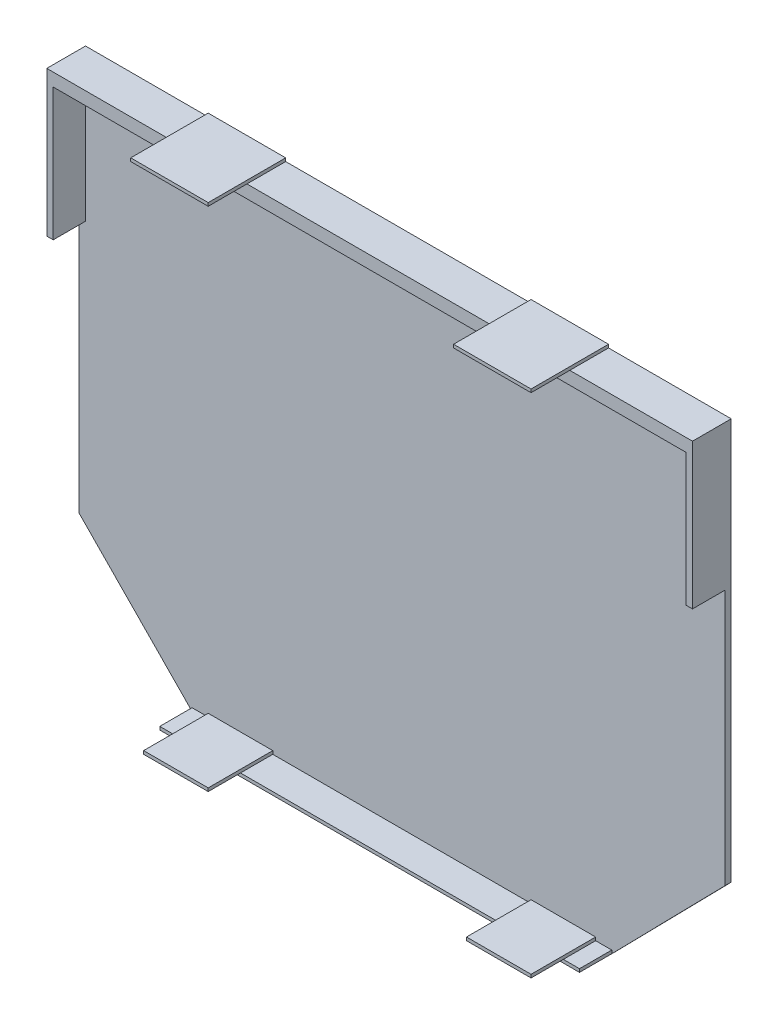
from build123d import *

# Parameters (mm, degrees)
STOCK_PART1_1_START       = -61
STOCK_PART1_1_DEPTH       = 2
STOCK_PART1_1_START_2     = -59
STOCK_PART1_1_2_OUTLINE_W = 130
STOCK_PART1_1_2_OUTLINE_H = 1
STOCK_PART1_1_2_DEPTH     = 10
SKETCH1_W                 = 24
SKETCH1_H                 = 24
BOSS_EXTRUDE1_DEPTH       = 1
SKETCH2_W                 = 20
SKETCH2_H                 = 20
BOSS_EXTRUDE2_DEPTH       = 1


# Read off the part's stored shape, not the designer's step: Stock-Part1-1
with BuildPart() as part:
    # Stock-Part1-1 outline → Stock-Part1-1 (new body)
    with BuildSketch(Plane.XY.offset(STOCK_PART1_1_START)):
        Polygon((0, 35.707142143), (35, 0), (165, 0), (200, 35.707142143), (200, 160), (0, 160), align=None)
    extrude(amount=STOCK_PART1_1_DEPTH)

    # Stock-Part1-1 2 outline → Stock-Part1-1 2 (add)
    with BuildSketch(Plane.XY.offset(STOCK_PART1_1_START_2)):
        with Locations((100, 0.5)):
            Rectangle(STOCK_PART1_1_2_OUTLINE_W, STOCK_PART1_1_2_OUTLINE_H)
        Polygon((198, 115), (200, 115), (200, 160), (0, 160), (0, 115), (2, 115), (2, 156), (198, 156), align=None)
    extrude(amount=STOCK_PART1_1_2_DEPTH)

    # Sketch1 → Boss-Extrude1 (add)
    with BuildSketch(Plane(origin=(0, 160, 0), x_dir=(1, 0, 0), z_dir=(0, 1, 0))):
        with Locations((150, 49)):
            Rectangle(SKETCH1_W, SKETCH1_H)
        with Locations((50, 49)):
            Rectangle(SKETCH1_W, SKETCH1_H)
    extrude(amount=BOSS_EXTRUDE1_DEPTH)

    # Sketch2 → Boss-Extrude2 (add)
    with BuildSketch(Plane(origin=(0, 1, 0), x_dir=(1, 0, 0), z_dir=(0, 1, 0))):
        with Locations((50, 49)):
            Rectangle(SKETCH2_W, SKETCH2_H)
        with Locations((150, 49)):
            Rectangle(SKETCH2_W, SKETCH2_H)
    extrude(amount=BOSS_EXTRUDE2_DEPTH)


solid = part.part
